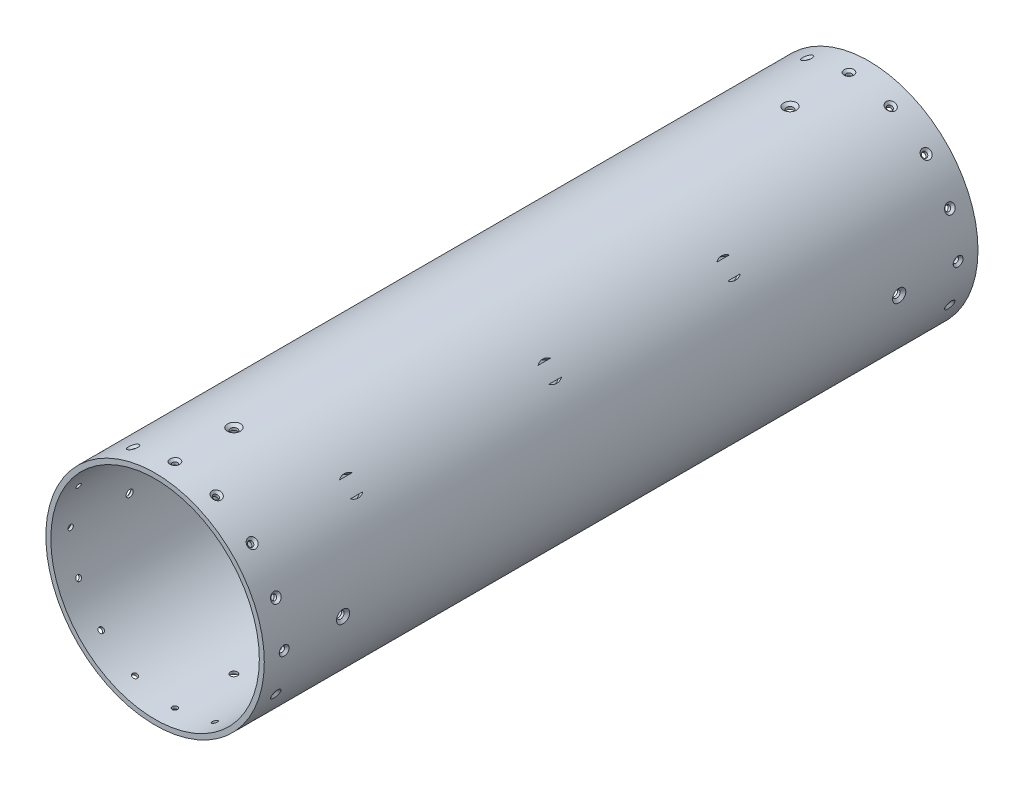
from build123d import *

# Parameters (mm, degrees)
SKETCH1_R                                       = 69.85
SKETCH1_R_2                                     = 66.675
EXTRUDE1_DEPTH                                  = 228.2063
CSK_FOR_M3_FLAT_HEAD_MACHINE_SCREW1_D           = 3.4
CSK_FOR_M3_FLAT_HEAD_MACHINE_SCREW1_CSINK_D     = 6.3
CSK_FOR_M3_FLAT_HEAD_MACHINE_SCREW1_CSINK_ANGLE = 90
CIRPATTERN1_COUNT                               = 16
MIRROR1_COPY_1_D                                = 3.4
MIRROR1_COPY_1_CSINK_D                          = 6.3
MIRROR1_COPY_1_CSINK_ANGLE                      = 90
MIRROR1_COPY_2_D                                = 3.4
MIRROR1_COPY_2_CSINK_D                          = 6.3
MIRROR1_COPY_2_CSINK_ANGLE                      = 90
MIRROR1_COPY_3_D                                = 3.4
MIRROR1_COPY_3_CSINK_D                          = 6.3
MIRROR1_COPY_3_CSINK_ANGLE                      = 90
MIRROR1_COPY_4_D                                = 3.4
MIRROR1_COPY_4_CSINK_D                          = 6.3
MIRROR1_COPY_4_CSINK_ANGLE                      = 90
MIRROR1_COPY_5_D                                = 3.4
MIRROR1_COPY_5_CSINK_D                          = 6.3
MIRROR1_COPY_5_CSINK_ANGLE                      = 90
MIRROR1_COPY_6_D                                = 3.4
MIRROR1_COPY_6_CSINK_D                          = 6.3
MIRROR1_COPY_6_CSINK_ANGLE                      = 90
MIRROR1_COPY_7_D                                = 3.4
MIRROR1_COPY_7_CSINK_D                          = 6.3
MIRROR1_COPY_7_CSINK_ANGLE                      = 90
MIRROR1_COPY_8_D                                = 3.4
MIRROR1_COPY_8_CSINK_D                          = 6.3
MIRROR1_COPY_8_CSINK_ANGLE                      = 90
MIRROR1_COPY_9_D                                = 3.4
MIRROR1_COPY_9_CSINK_D                          = 6.3
MIRROR1_COPY_9_CSINK_ANGLE                      = 90
MIRROR1_COPY_10_D                               = 3.4
MIRROR1_COPY_10_CSINK_D                         = 6.3
MIRROR1_COPY_10_CSINK_ANGLE                     = 90
MIRROR1_COPY_11_D                               = 3.4
MIRROR1_COPY_11_CSINK_D                         = 6.3
MIRROR1_COPY_11_CSINK_ANGLE                     = 90
MIRROR1_COPY_12_D                               = 3.4
MIRROR1_COPY_12_CSINK_D                         = 6.3
MIRROR1_COPY_12_CSINK_ANGLE                     = 90
MIRROR1_COPY_13_D                               = 3.4
MIRROR1_COPY_13_CSINK_D                         = 6.3
MIRROR1_COPY_13_CSINK_ANGLE                     = 90
MIRROR1_COPY_14_D                               = 3.4
MIRROR1_COPY_14_CSINK_D                         = 6.3
MIRROR1_COPY_14_CSINK_ANGLE                     = 90
MIRROR1_COPY_15_D                               = 3.4
MIRROR1_COPY_15_CSINK_D                         = 6.3
MIRROR1_COPY_15_CSINK_ANGLE                     = 90
CSK_FOR_8_FLAT_HEAD_MACHINE_SCREW_2_COUNT       = 2
CSK_FOR_8_FLAT_HEAD_MACHINE_SCREW_2_PITCH       = 355.6
CIRPATTERN2_COUNT                               = 4
F_1_2_START                                     = 66.371930149
F_1_2_0_5_DIAMETER_HOLE2_OUTLINE_R              = 6.35
F_1_2_0_5_DIAMETER_HOLE2_DEPTH                  = 3.303603642


# Read off the part's stored shape, not the designer's step: 1/2 (0.5) Diameter Hole2
with BuildPart() as part:
    # Sketch1 → Extrude1 (new body)
    with BuildSketch(Plane.XY):
        Circle(SKETCH1_R)
        Circle(SKETCH1_R_2, mode=Mode.SUBTRACT)
    extrude1 = extrude(amount=EXTRUDE1_DEPTH)

    # CSK for M3 Flat Head Machine Screw1 (through all)
    with Locations(Plane(origin=(0, -69.85, 215.5063), x_dir=(1, 0, 0), z_dir=(0, -1, 0))):
        with Locations((0, 0)):
            csk_for_m3_flat_head_machine_screw1 = CounterSinkHole(CSK_FOR_M3_FLAT_HEAD_MACHINE_SCREW1_D / 2, CSK_FOR_M3_FLAT_HEAD_MACHINE_SCREW1_CSINK_D / 2, counter_sink_angle=CSK_FOR_M3_FLAT_HEAD_MACHINE_SCREW1_CSINK_ANGLE)

    # CirPattern1: CSK for M3 Flat Head Machine Screw1 ×16 about axis
    cirpattern1_axis = Axis((0, 0, 228.2063), (0, 0, -1))
    for i in range(1, CIRPATTERN1_COUNT):
        add(csk_for_m3_flat_head_machine_screw1.rotate(cirpattern1_axis, i * 360 / CIRPATTERN1_COUNT), mode=Mode.SUBTRACT)

    # Mirror1: Extrude1, CSK for M3 Flat Head Machine Screw1 across plane
    add(extrude1.mirror(Plane.XY))
    add(csk_for_m3_flat_head_machine_screw1.mirror(Plane.XY), mode=Mode.SUBTRACT)

    # Mirror1 copy 1 (through all)
    with Locations(Plane(origin=(-26.730437751, -64.532985346, -215.5063), x_dir=(0.9238795325112868, -0.3826834323650896, 0), z_dir=(-0.3826834323650896, -0.9238795325112868, 0))):
        with Locations((0, 0)):
            CounterSinkHole(MIRROR1_COPY_1_D / 2, MIRROR1_COPY_1_CSINK_D / 2, counter_sink_angle=MIRROR1_COPY_1_CSINK_ANGLE)

    # Mirror1 copy 2 (through all)
    with Locations(Plane(origin=(-49.391408666, -49.391408666, -215.5063), x_dir=(0.7071067811865477, -0.7071067811865474, 0), z_dir=(-0.7071067811865474, -0.7071067811865477, 0))):
        with Locations((0, 0)):
            CounterSinkHole(MIRROR1_COPY_2_D / 2, MIRROR1_COPY_2_CSINK_D / 2, counter_sink_angle=MIRROR1_COPY_2_CSINK_ANGLE)

    # Mirror1 copy 3 (through all)
    with Locations(Plane(origin=(-64.532985346, -26.730437751, -215.5063), x_dir=(0.38268343236509, -0.9238795325112866, 0), z_dir=(-0.9238795325112866, -0.38268343236509, 0))):
        with Locations((0, 0)):
            CounterSinkHole(MIRROR1_COPY_3_D / 2, MIRROR1_COPY_3_CSINK_D / 2, counter_sink_angle=MIRROR1_COPY_3_CSINK_ANGLE)

    # Mirror1 copy 4 (through all)
    with Locations(Plane(origin=(-69.85, 0, -215.5063), x_dir=(0, -1, 0), z_dir=(-1, 0, 0))):
        with Locations((0, 0)):
            CounterSinkHole(MIRROR1_COPY_4_D / 2, MIRROR1_COPY_4_CSINK_D / 2, counter_sink_angle=MIRROR1_COPY_4_CSINK_ANGLE)

    # Mirror1 copy 5 (through all)
    with Locations(Plane(origin=(-64.532985346, 26.730437751, -215.5063), x_dir=(-0.38268343236508956, -0.9238795325112868, 0), z_dir=(-0.9238795325112868, 0.38268343236508956, 0))):
        with Locations((0, 0)):
            CounterSinkHole(MIRROR1_COPY_5_D / 2, MIRROR1_COPY_5_CSINK_D / 2, counter_sink_angle=MIRROR1_COPY_5_CSINK_ANGLE)

    # Mirror1 copy 6 (through all)
    with Locations(Plane(origin=(-49.391408666, 49.391408666, -215.5063), x_dir=(-0.7071067811865474, -0.7071067811865477, 0), z_dir=(-0.7071067811865477, 0.7071067811865474, 0))):
        with Locations((0, 0)):
            CounterSinkHole(MIRROR1_COPY_6_D / 2, MIRROR1_COPY_6_CSINK_D / 2, counter_sink_angle=MIRROR1_COPY_6_CSINK_ANGLE)

    # Mirror1 copy 7 (through all)
    with Locations(Plane(origin=(-26.730437751, 64.532985346, -215.5063), x_dir=(-0.9238795325112866, -0.38268343236509006, 0), z_dir=(-0.38268343236509006, 0.9238795325112866, 0))):
        with Locations((0, 0)):
            CounterSinkHole(MIRROR1_COPY_7_D / 2, MIRROR1_COPY_7_CSINK_D / 2, counter_sink_angle=MIRROR1_COPY_7_CSINK_ANGLE)

    # Mirror1 copy 8 (through all)
    with Locations(Plane(origin=(0, 69.85, -215.5063), x_dir=(-1, 0, 0), z_dir=(0, 1, 0))):
        with Locations((0, 0)):
            CounterSinkHole(MIRROR1_COPY_8_D / 2, MIRROR1_COPY_8_CSINK_D / 2, counter_sink_angle=MIRROR1_COPY_8_CSINK_ANGLE)

    # Mirror1 copy 9 (through all)
    with Locations(Plane(origin=(26.730437751, 64.532985346, -215.5063), x_dir=(-0.923879532511287, 0.3826834323650895, 0), z_dir=(0.3826834323650895, 0.923879532511287, 0))):
        with Locations((0, 0)):
            CounterSinkHole(MIRROR1_COPY_9_D / 2, MIRROR1_COPY_9_CSINK_D / 2, counter_sink_angle=MIRROR1_COPY_9_CSINK_ANGLE)

    # Mirror1 copy 10 (through all)
    with Locations(Plane(origin=(49.391408666, 49.391408666, -215.5063), x_dir=(-0.7071067811865478, 0.7071067811865474, 0), z_dir=(0.7071067811865474, 0.7071067811865478, 0))):
        with Locations((0, 0)):
            CounterSinkHole(MIRROR1_COPY_10_D / 2, MIRROR1_COPY_10_CSINK_D / 2, counter_sink_angle=MIRROR1_COPY_10_CSINK_ANGLE)

    # Mirror1 copy 11 (through all)
    with Locations(Plane(origin=(64.532985346, 26.730437751, -215.5063), x_dir=(-0.38268343236508967, 0.9238795325112867, 0), z_dir=(0.9238795325112867, 0.38268343236508967, 0))):
        with Locations((0, 0)):
            CounterSinkHole(MIRROR1_COPY_11_D / 2, MIRROR1_COPY_11_CSINK_D / 2, counter_sink_angle=MIRROR1_COPY_11_CSINK_ANGLE)

    # Mirror1 copy 12 (through all)
    with Locations(Plane(origin=(69.85, 0, -215.5063), x_dir=(0, 1, 0), z_dir=(1, 0, 0))):
        with Locations((0, 0)):
            CounterSinkHole(MIRROR1_COPY_12_D / 2, MIRROR1_COPY_12_CSINK_D / 2, counter_sink_angle=MIRROR1_COPY_12_CSINK_ANGLE)

    # Mirror1 copy 13 (through all)
    with Locations(Plane(origin=(64.532985346, -26.730437751, -215.5063), x_dir=(0.38268343236508984, 0.9238795325112867, 0), z_dir=(0.9238795325112867, -0.38268343236508984, 0))):
        with Locations((0, 0)):
            CounterSinkHole(MIRROR1_COPY_13_D / 2, MIRROR1_COPY_13_CSINK_D / 2, counter_sink_angle=MIRROR1_COPY_13_CSINK_ANGLE)

    # Mirror1 copy 14 (through all)
    with Locations(Plane(origin=(49.391408666, -49.391408666, -215.5063), x_dir=(0.7071067811865472, 0.7071067811865478, 0), z_dir=(0.7071067811865478, -0.7071067811865472, 0))):
        with Locations((0, 0)):
            CounterSinkHole(MIRROR1_COPY_14_D / 2, MIRROR1_COPY_14_CSINK_D / 2, counter_sink_angle=MIRROR1_COPY_14_CSINK_ANGLE)

    # Mirror1 copy 15 (through all)
    with Locations(Plane(origin=(26.730437751, -64.532985346, -215.5063), x_dir=(0.9238795325112867, 0.3826834323650897, 0), z_dir=(0.3826834323650897, -0.9238795325112867, 0))):
        with Locations((0, 0)):
            CounterSinkHole(MIRROR1_COPY_15_D / 2, MIRROR1_COPY_15_CSINK_D / 2, counter_sink_angle=MIRROR1_COPY_15_CSINK_ANGLE)

    # Sketch9 → CSK for #8 Flat Head Machine Screw (100)3 (revolve, cut)
    with BuildSketch(Plane(origin=(0, -69.85, -177.8127), x_dir=(0, 0, -1), z_dir=(1, 0, 0))):
        Polygon((0, 0), (0, 13.542674586), (2.2479, 12.192), (2.2479, 1.651767624), (4.2164, 0), align=None)
    csk_for_8_flat_head_machine_screw_100 = revolve(axis=Axis((0, -76.2, -177.8127), (0, 1, 0)), mode=Mode.SUBTRACT)

    # CSK for _8 Flat Head Machine Screw _ 2: CSK for #8 Flat Head Machine Screw (100)3 ×2
    with Locations(*[(0, 0, i * CSK_FOR_8_FLAT_HEAD_MACHINE_SCREW_2_PITCH) for i in range(1, CSK_FOR_8_FLAT_HEAD_MACHINE_SCREW_2_COUNT)]):
        add(csk_for_8_flat_head_machine_screw_100, mode=Mode.SUBTRACT)

    # CirPattern2: CSK for #8 Flat Head Machine Screw (100)3 ×4 about axis
    cirpattern2_axis = Axis((0, 0, 228.2063), (0, 0, -1))
    for i in range(1, CIRPATTERN2_COUNT):
        add(csk_for_8_flat_head_machine_screw_100.rotate(cirpattern2_axis, i * 360 / CIRPATTERN2_COUNT), mode=Mode.SUBTRACT)

    # CirPattern2 copy 1 sketch → CirPattern2 copy 1 (revolve, cut)
    with BuildSketch(Plane(origin=(-69.85, 0, 177.7873), x_dir=(0, 0, -1), z_dir=(0, -1, 0))):
        Polygon((0, 0), (0, 13.542674586), (2.2479, 12.192), (2.2479, 1.651767624), (4.2164, 0), align=None)
    revolve(axis=Axis((-76.2, 0, 177.7873), (1, 0, 0)), mode=Mode.SUBTRACT)

    # CirPattern2 copy 2 sketch → CirPattern2 copy 2 (revolve, cut)
    with BuildSketch(Plane(origin=(0, 69.85, 177.7873), x_dir=(0, 0, -1), z_dir=(-1, 0, 0))):
        Polygon((0, 0), (0, 13.542674586), (2.2479, 12.192), (2.2479, 1.651767624), (4.2164, 0), align=None)
    revolve(axis=Axis((0, 76.2, 177.7873), (0, -1, 0)), mode=Mode.SUBTRACT)

    # CirPattern2 copy 3 sketch → CirPattern2 copy 3 (revolve, cut)
    with BuildSketch(Plane(origin=(69.85, 0, 177.7873), x_dir=(0, 0, -1), z_dir=(0, 1, 0))):
        Polygon((0, 0), (0, 13.542674586), (2.2479, 12.192), (2.2479, 1.651767624), (4.2164, 0), align=None)
    revolve(axis=Axis((76.2, 0, 177.7873), (-1, 0, 0)), mode=Mode.SUBTRACT)

    # 1/2 (0.5) Diameter Hole2 outline → 1/2 (0.5) Diameter Hole2 (cut)
    with BuildSketch(Plane(origin=(0, 0, 0), x_dir=(0.707106781186546, -0.707106781186549, 0), z_dir=(0.707106781186549, 0.707106781186546, 0)).offset(F_1_2_START)):
        with Locations((0, -25.019693495)):
            Circle(F_1_2_0_5_DIAMETER_HOLE2_OUTLINE_R)
        with Locations((0, 89.280306505)):
            Circle(F_1_2_0_5_DIAMETER_HOLE2_OUTLINE_R)
        with Locations((0, -152.019693495)):
            Circle(F_1_2_0_5_DIAMETER_HOLE2_OUTLINE_R)
    extrude(amount=F_1_2_0_5_DIAMETER_HOLE2_DEPTH, mode=Mode.SUBTRACT)


solid = part.part
